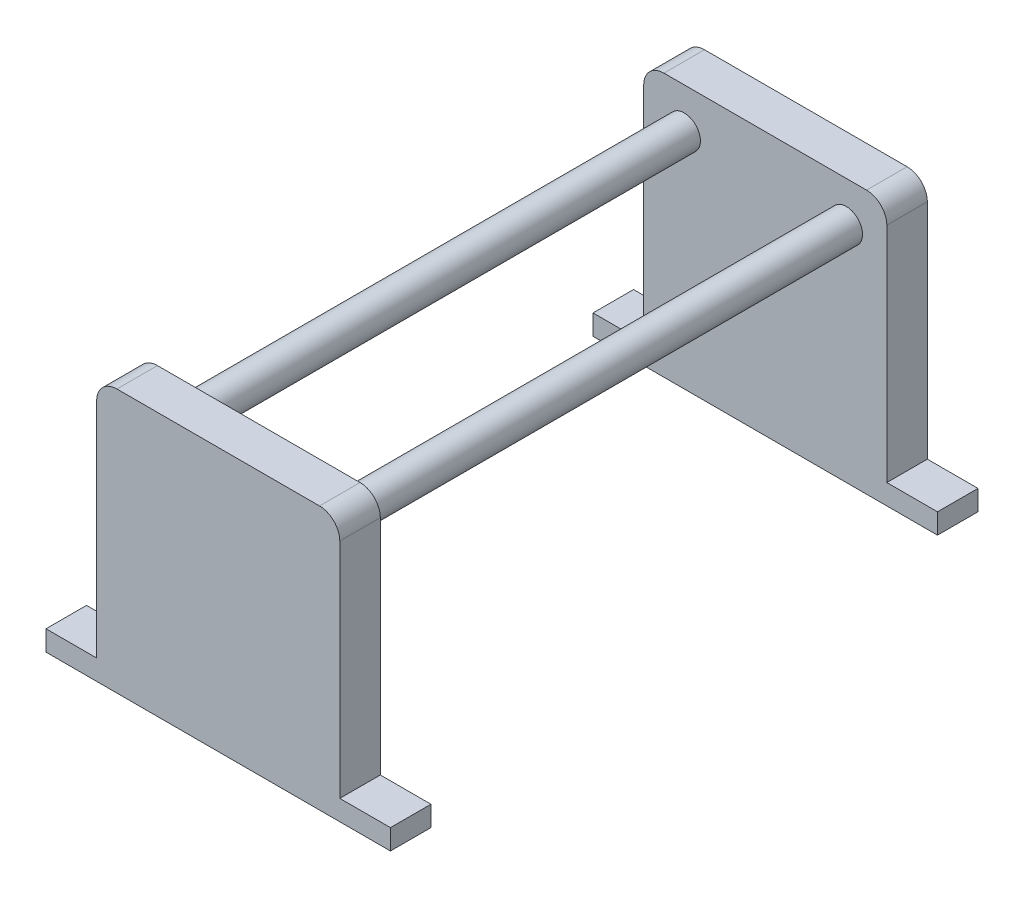
from build123d import *

# Parameters (mm, degrees)
SALIENTE_EXTRUIR1_DEPTH = 10
REDONDEO1_R             = 5
CROQUIS2_R              = 4
SALIENTE_EXTRUIR2_DEPTH = 125
SALIENTE_EXTRUIR4_DEPTH = 10
REDONDEO2_R             = 5


with BuildPart() as part:
    # Croquis1 → Saliente-Extruir1 (new body)
    with BuildSketch(Plane.XY):
        Polygon((30, -30), (30, 30), (-30, 30), (-30, -30), (-42.5, -30), (-42.5, -35), (42.5, -35), (42.5, -30), align=None)
    extrude(amount=SALIENTE_EXTRUIR1_DEPTH)

    # Redondeo1
    redondeo1_edges = [part.edges().sort_by_distance(p)[0] for p in [
        (30, 30, 5),
        (-30, 30, 5),
    ]]
    fillet(redondeo1_edges, radius=REDONDEO1_R)

    # Croquis2 → Saliente-Extruir2 (add)
    with BuildSketch(Plane(origin=(0, 0, 0), x_dir=(-1, 0, 0), z_dir=(0, 0, -1))):
        with Locations((-20, 20)):
            Circle(CROQUIS2_R)
        with Locations((20, 20)):
            Circle(CROQUIS2_R)
    extrude(amount=SALIENTE_EXTRUIR2_DEPTH)

    # Croquis3 → Saliente-Extruir4 (add)
    with BuildSketch(Plane(origin=(0, 0, -125), x_dir=(-1, 0, 0), z_dir=(0, 0, -1))):
        Polygon((30, 30), (-30, 30), (-30, -30), (-42.5, -30), (-42.5, -35), (42.5, -35), (42.5, -30), (30, -30), align=None)
    extrude(amount=SALIENTE_EXTRUIR4_DEPTH)

    # Redondeo2
    redondeo2_edges = [part.edges().sort_by_distance(p)[0] for p in [
        (30, 30, -130),
        (-30, 30, -130),
    ]]
    fillet(redondeo2_edges, radius=REDONDEO2_R)


solid = part.part
